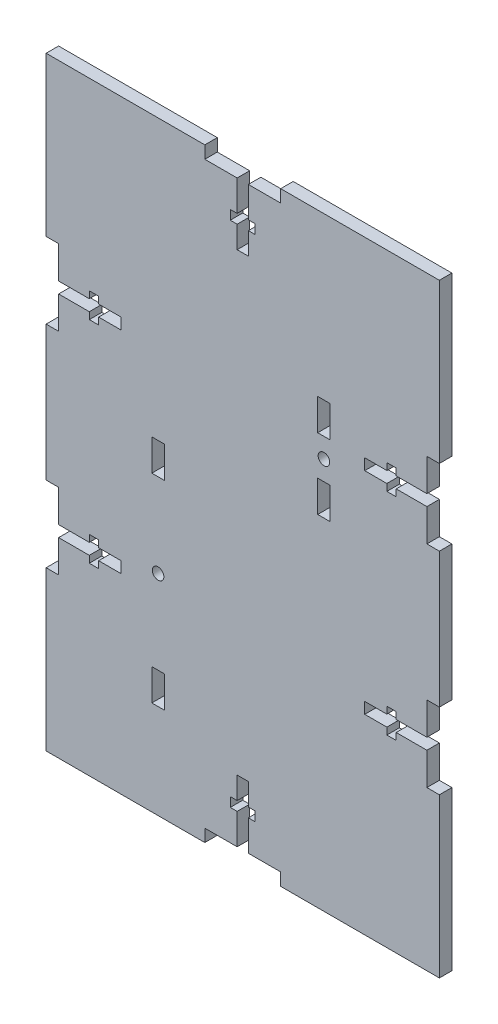
from build123d import *

# Parameters (mm, degrees)
BOSS_EXTRUDE1_DEPTH = 3.18
CUT_EXTRUDE9_DEPTH  = 92.718008183
CUT_EXTRUDE10_DEPTH = 92.718008183
SKETCH32_4_W        = 3.18
SKETCH32_4_H        = 8
SKETCH32_4_R        = 1.47
CUT_EXTRUDE18_DEPTH = 92.718008183
SKETCH33_3_W        = 3.18
SKETCH33_3_H        = 8
SKETCH33_3_R        = 1.47
CUT_EXTRUDE29_DEPTH = 92.718008183


with BuildPart() as part:
    # Sketch1 → Boss-Extrude1 (new body)
    with BuildSketch(Plane.XY):
        Polygon((-50, 76.825), (-16.666666667, 76.825), (16.666666667, 76.825), (50, 76.825), (50, -76.825), (-50, -76.825), align=None)
    extrude(amount=BOSS_EXTRUDE1_DEPTH)

    # Sketch20 → Cut-Extrude9 (cut, through all)
    with BuildSketch(Plane.XY.offset(3.18)):
        Polygon((-9.65, 76.825), (9.65, 76.825), (9.65, 73.645), (1.425, 73.645), (1.425, 65.845), (3.175, 65.845), (3.175, 63.465), (1.425, 63.465), (1.425, 57.845), (-1.425, 57.845), (-1.425, 63.465), (-3.175, 63.465), (-3.175, 65.845), (-1.425, 65.845), (-1.425, 73.645), (-9.65, 73.645), align=None)
    cut_extrude9 = extrude(amount=-CUT_EXTRUDE9_DEPTH, mode=Mode.SUBTRACT)

    # Mirror3: Cut-Extrude9 across plane
    add(cut_extrude9.mirror(Plane.ZX), mode=Mode.SUBTRACT)

    # Sketch23 → Cut-Extrude10 (cut, through all)
    with BuildSketch(Plane.XY.offset(3.18)):
        Polygon((-50, 17.175), (-50, 36.475), (-46.82, 36.475), (-46.82, 28.25), (-39.02, 28.25), (-39.02, 30), (-36.64, 30), (-36.64, 28.25), (-31.02, 28.25), (-31.02, 25.4), (-36.64, 25.4), (-36.64, 23.65), (-39.02, 23.65), (-39.02, 25.4), (-46.82, 25.4), (-46.82, 17.175), align=None)
        Polygon((-50, -36.475), (-50, -17.175), (-46.82, -17.175), (-46.82, -25.4), (-39.02, -25.4), (-39.02, -23.65), (-36.64, -23.65), (-36.64, -25.4), (-31.02, -25.4), (-31.02, -28.25), (-36.64, -28.25), (-36.64, -30), (-39.02, -30), (-39.02, -28.25), (-46.82, -28.25), (-46.82, -36.475), align=None)
    cut_extrude10 = extrude(amount=-CUT_EXTRUDE10_DEPTH, mode=Mode.SUBTRACT)

    # Mirror4: Cut-Extrude10 across plane
    add(cut_extrude10.mirror(Plane(origin=(0, 0, 0), x_dir=(0, 0, 1), z_dir=(1, 0, 0))), mode=Mode.SUBTRACT)

    # Sketch32<4> → Cut-Extrude18 (cut, through all)
    with BuildSketch(Plane.XY.offset(3.18)):
        with Locations((20.65, 13.782937163)):
            Rectangle(SKETCH32_4_W, SKETCH32_4_H)
        with Locations((20.65, 31.782937163)):
            Rectangle(SKETCH32_4_W, SKETCH32_4_H)
        with Locations((20.65, 22.782937163)):
            Circle(SKETCH32_4_R)
    extrude(amount=-CUT_EXTRUDE18_DEPTH, mode=Mode.SUBTRACT)

    # Sketch33<3> → Cut-Extrude29 (cut, through all)
    with BuildSketch(Plane.XY):
        with Locations((-21.530032845, -48.811577341)):
            Rectangle(SKETCH33_3_W, SKETCH33_3_H)
        with Locations((-21.530032845, 1.788422659)):
            Rectangle(SKETCH33_3_W, SKETCH33_3_H)
        with Locations((-21.530032845, -23.511577341)):
            Circle(SKETCH33_3_R)
    extrude(amount=CUT_EXTRUDE29_DEPTH, mode=Mode.SUBTRACT)


solid = part.part
